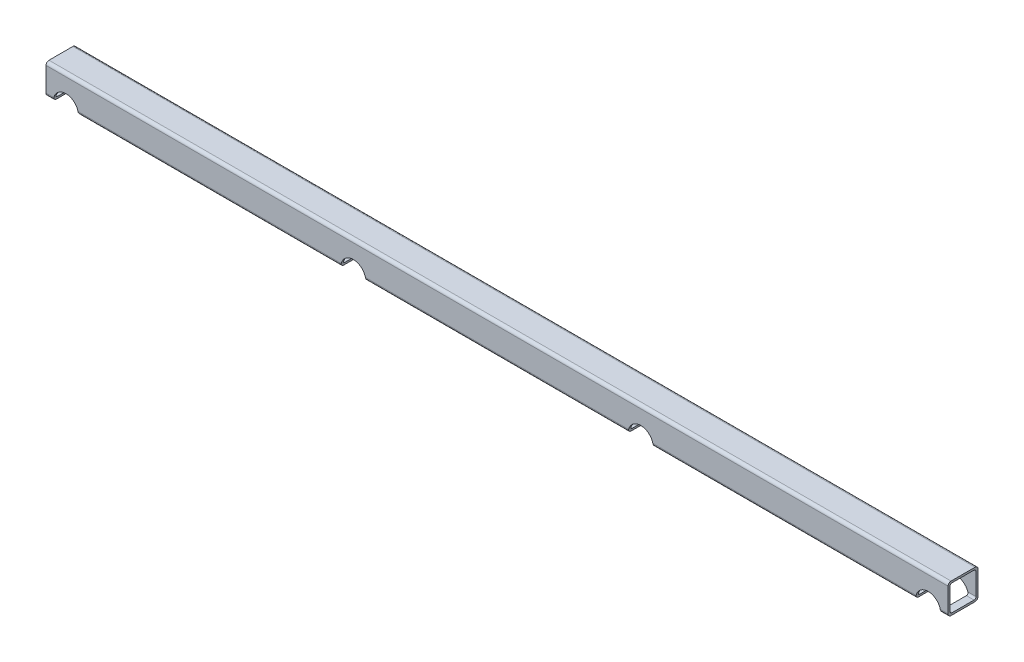
from build123d import *

# Parameters (mm, degrees)
EXTRUDE_1_DEPTH      = 884.980118
EXTRUDE_1_DEPTH_BACK = 20
OTHER_START          = -15
OTHER_2_DEPTH        = 30


# Read off the part's stored shape, not the designer's step: Полость2
with BuildPart() as part:
    # Эскиз1 → Бобышка-Вытянуть1 (new, two sides: drawn at the far end of the back side and taken through both)
    with BuildSketch(Plane(origin=(0, 0, 0), x_dir=(0, 0, -1), z_dir=(1, 0, 0)).offset(-EXTRUDE_1_DEPTH_BACK)):
        with BuildLine():
            Line((-12, 30), (12, 30))
            ThreePointArc((12, 30), (14.121320344, 29.121320344), (15, 27))
            Line((15, 27), (15, 3))
            ThreePointArc((15, 3), (14.121320344, 0.878679656), (12, 0))
            Line((12, 0), (-12, 0))
            ThreePointArc((-12, 0), (-14.121320344, 0.878679656), (-15, 3))
            Line((-15, 3), (-15, 27))
            ThreePointArc((-15, 27), (-14.121320344, 29.121320344), (-12, 30))
        make_face()
        with BuildLine():
            Line((-11, 28), (11, 28))
            ThreePointArc((11, 28), (12.414213562, 27.414213562), (13, 26))
            Line((13, 26), (13, 4))
            ThreePointArc((13, 4), (12.414213562, 2.585786438), (11, 2))
            Line((11, 2), (-11, 2))
            ThreePointArc((-11, 2), (-12.414213562, 2.585786438), (-13, 4))
            Line((-13, 4), (-13, 26))
            ThreePointArc((-13, 26), (-12.414213562, 27.414213562), (-11, 28))
        make_face(mode=Mode.SUBTRACT)
    extrude(amount=EXTRUDE_1_DEPTH + EXTRUDE_1_DEPTH_BACK)

    # Полость2 outline → Полость2 (cut)
    with BuildSketch(Plane.XY.offset(OTHER_START)):
        with BuildLine():
            Line((852.480118087, -4.981e-06), (877.480118087, -4.981e-06))
            ThreePointArc((877.480118087, -4.981e-06), (877.439793915, 1.003233908), (877.319080766, 2))
            Line((877.319080766, 2), (852.641155408, 2))
            ThreePointArc((852.641155408, 2), (852.52044226, 1.003233908), (852.480118087, -4.981e-06))
        make_face()
        with BuildLine():
            Line((852.641155408, 2), (877.319080766, 2))
            ThreePointArc((877.319080766, 2), (864.980118087, 12.5), (852.641155408, 2))
        make_face()
        with BuildLine():
            Line((564.153412058, -4.981e-06), (589.153412058, -4.981e-06))
            ThreePointArc((589.153412058, -4.981e-06), (589.113087885, 1.003233908), (588.992374737, 2))
            Line((588.992374737, 2), (564.314449379, 2))
            ThreePointArc((564.314449379, 2), (564.193736231, 1.003233908), (564.153412058, -4.981e-06))
        make_face()
        with BuildLine():
            Line((564.314449379, 2), (588.992374737, 2))
            ThreePointArc((588.992374737, 2), (576.653412058, 12.5), (564.314449379, 2))
        make_face()
        with BuildLine():
            Line((275.826706029, -4.981e-06), (300.826706029, -4.981e-06))
            ThreePointArc((300.826706029, -4.981e-06), (300.786381856, 1.003233908), (300.665668708, 2))
            Line((300.665668708, 2), (275.98774335, 2))
            ThreePointArc((275.98774335, 2), (275.867030202, 1.003233908), (275.826706029, -4.981e-06))
        make_face()
        with BuildLine():
            Line((275.98774335, 2), (300.665668708, 2))
            ThreePointArc((300.665668708, 2), (288.326706029, 12.5), (275.98774335, 2))
        make_face()
        with BuildLine():
            Line((-12.5, -4.981e-06), (12.5, -4.981e-06))
            ThreePointArc((12.5, -4.981e-06), (12.459675827, 1.003233908), (12.338962679, 2))
            Line((12.338962679, 2), (-12.338962679, 2))
            ThreePointArc((-12.338962679, 2), (-12.459675827, 1.003233908), (-12.5, -4.981e-06))
        make_face()
        with BuildLine():
            Line((-12.338962679, 2), (12.338962679, 2))
            ThreePointArc((12.338962679, 2), (0, 12.5), (-12.338962679, 2))
        make_face()
    extrude(amount=OTHER_2_DEPTH, mode=Mode.SUBTRACT)


solid = part.part
